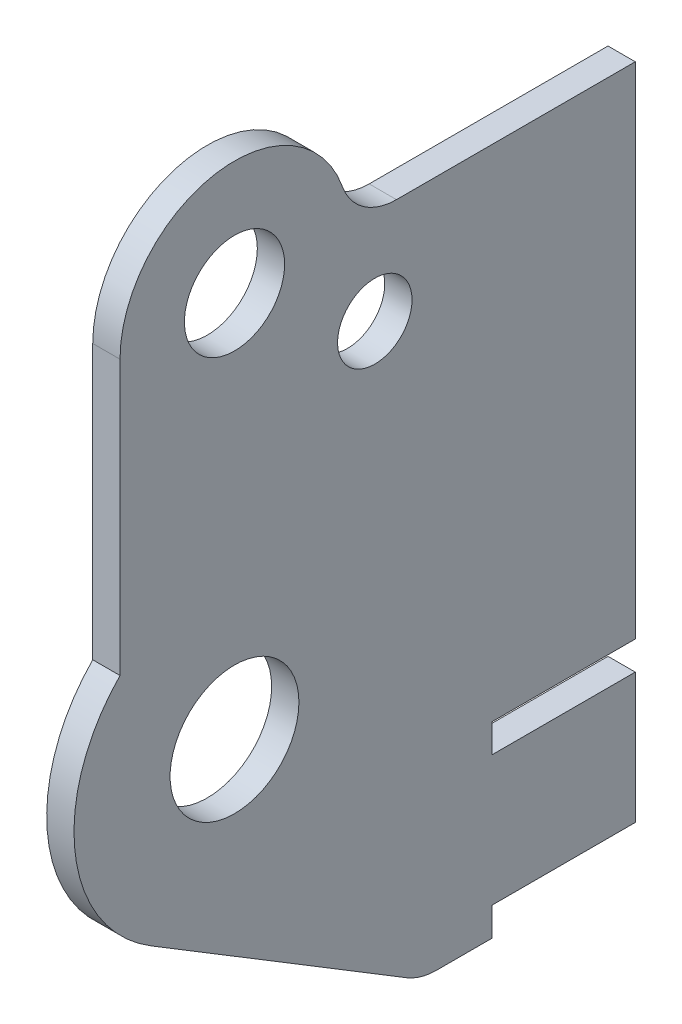
from build123d import *

# Parameters (mm, degrees)
ESBO_O1_R          = 17.5
ESBO_O1_R_2        = 22.5
ESBO_O1_R_3        = 13
FLANGE_BASE1_DEPTH = 9.53


# Sheet-metal steps are written as plain solids
with BuildPart() as part:
    # Esboço1 → Flange-base1 (new body)
    with BuildSketch(Plane(origin=(0, 0, 0), x_dir=(0, 0, -1), z_dir=(1, 0, 0))):
        with BuildLine():
            Line((-40, 0), (-40, -95.693939399))
            ThreePointArc((-40, -95.693939399), (-55.649819015, -141.93282364), (-29.1335895, -182.918684903))
            Line((-29.1335895, -182.918684903), (60.212673691, -237.239402604))
            ThreePointArc((60.212673691, -237.239402604), (65.207688943, -239.408609141), (70.602684212, -240.15))
            Line((70.602684212, -240.15), (90, -240.15))
            Line((90, -240.15), (90, -230.15))
            Line((90, -230.15), (140, -230.15))
            Line((140, -230.15), (140, -184.65))
            Line((140, -184.65), (90, -184.65))
            Line((90, -184.65), (90, -174.65))
            Line((90, -174.65), (140, -174.65))
            Line((140, -174.65), (140, 0))
            Line((140, 0), (56.568542495, 0))
            ThreePointArc((56.568542495, 0), (45.021537111, 3.670068381), (37.712361663, 13.333333333))
            ThreePointArc((37.712361663, 13.333333333), (-6.764079149, 39.423942386), (-40, 0))
        make_face()
        Circle(ESBO_O1_R, mode=Mode.SUBTRACT)
        with Locations((0, -135)):
            Circle(ESBO_O1_R_2, mode=Mode.SUBTRACT)
        with Locations((49.01, -33)):
            Circle(ESBO_O1_R_3, mode=Mode.SUBTRACT)
    extrude(amount=-FLANGE_BASE1_DEPTH)


solid = part.part
